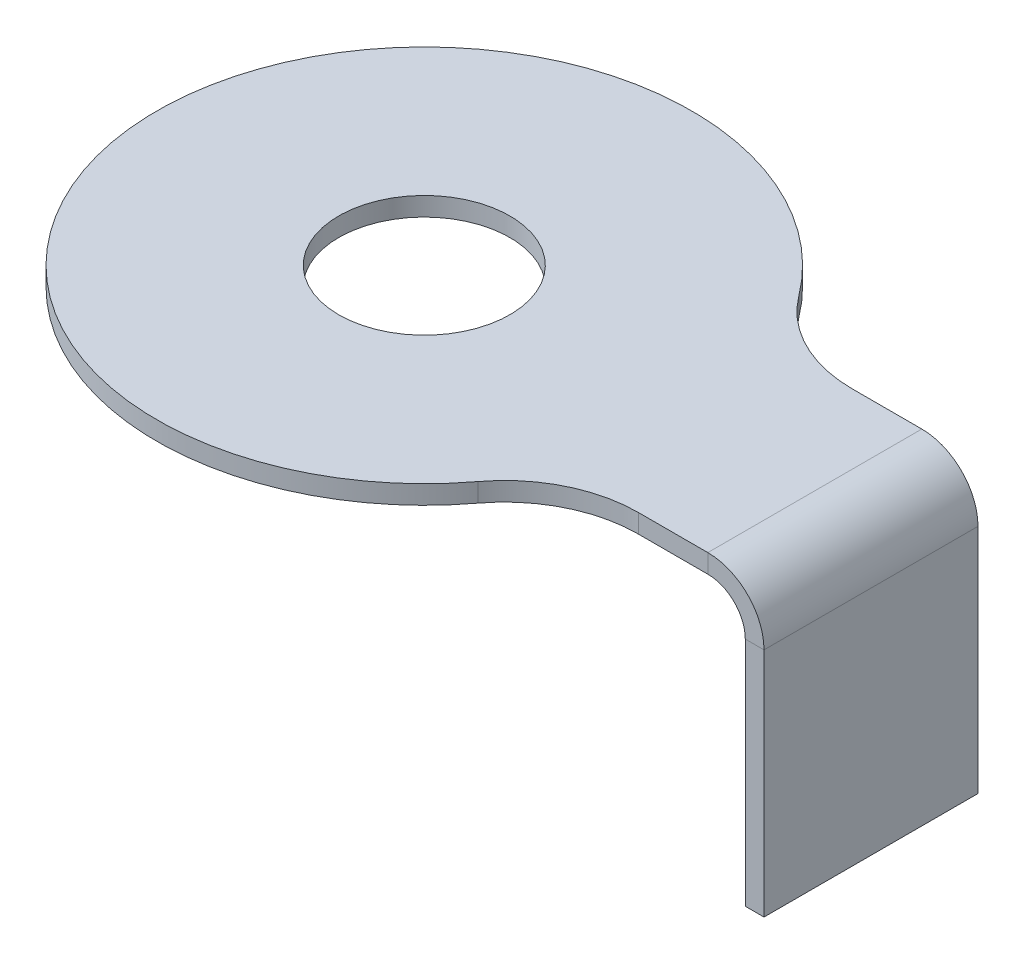
from build123d import *

# Parameters (mm, degrees)
SKICA1_R               = 1.6
Z_KLADN_PLECH1_DEPTH   = 0.35
OHYB_START             = -2
OHYB_ZE_SKICI1_DEPTH   = 4
OHYB_ZE_SKICI1_2_DEPTH = 4


# Read off the part's stored shape, not the designer's step: Ohyb ze skici1
# Sheet-metal steps are written as plain solids
with BuildPart() as part:
    # Skica1 → Základní plech1 (new body)
    with BuildSketch(Plane(origin=(0, 0, 0), x_dir=(1, 0, 0), z_dir=(0, 1, 0))):
        with BuildLine():
            Line((6, 2), (13, 2))
            Line((13, 2), (13, -2))
            Line((13, -2), (6, -2))
            ThreePointArc((6, -2), (4.881966011, -2.263932023), (4, -3))
            ThreePointArc((4, -3), (-5, 0), (4, 3))
            ThreePointArc((4, 3), (4.881966011, 2.263932023), (6, 2))
        make_face()
        with Locations(Location((0, 0, 0), (0, 0, 270))):
            Circle(SKICA1_R, mode=Mode.SUBTRACT)
    extrude(amount=Z_KLADN_PLECH1_DEPTH)

    # Ohyb ze skici1 outline → Ohyb ze skici1 (cut)
    with BuildSketch(Plane.XY.offset(OHYB_START)):
        with BuildLine():
            ThreePointArc((7.3, 0.350000005), (7.728660709, 0.258514479), (8.082623799, 0))
            Line((8.082623799, 0), (13, 0))
            Line((13, 0), (13, 0.35))
            Line((13, 0.35), (7.3, 0.350000005))
        make_face()
    extrude(amount=OHYB_ZE_SKICI1_DEPTH, mode=Mode.SUBTRACT)

    # Ohyb ze skici1 2 outline → Ohyb ze skici1 2 (add)
    with BuildSketch(Plane.XY.offset(OHYB_START)):
        with BuildLine():
            Line((8.35, -5.025553214), (8.350000005, -0.700000005))
            ThreePointArc((8.350000005, -0.700000005), (8.280880984, -0.325336808), (8.082623799, 0))
            Line((8.082623799, 0), (7.3, 5e-09))
            ThreePointArc((7.3, 5e-09), (7.79497475, -0.20502525), (8.000000005, -0.7))
            Line((8.000000005, -0.7), (8, -5.025553214))
            Line((8, -5.025553214), (8.35, -5.025553214))
        make_face()
    extrude(amount=OHYB_ZE_SKICI1_2_DEPTH)


solid = part.part
